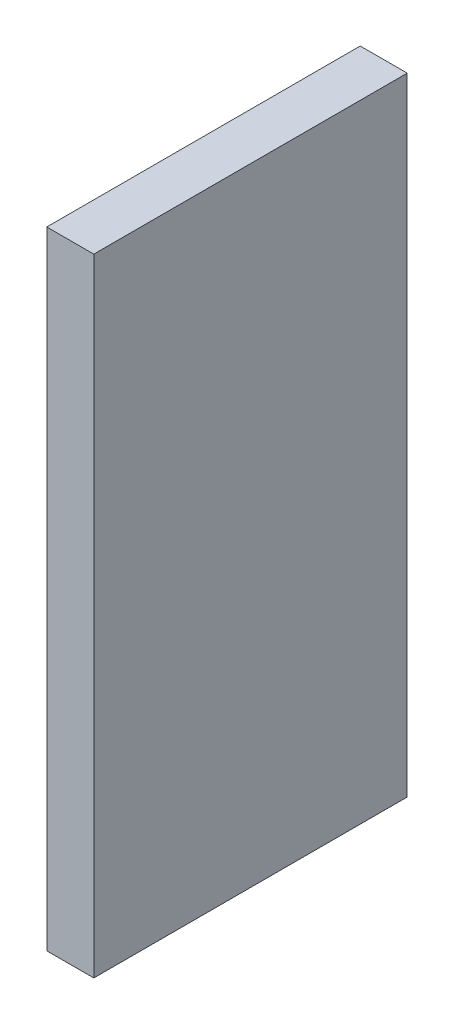
from build123d import *

# Parameters (mm, degrees)
SKETCH1_W           = 80
SKETCH1_H           = 40
BOSS_EXTRUDE2_DEPTH = 6


with BuildPart() as part:
    # Sketch1 → Boss-Extrude2 (new body)
    with BuildSketch(Plane.YZ):
        Rectangle(SKETCH1_W, SKETCH1_H)
    extrude(amount=BOSS_EXTRUDE2_DEPTH)


solid = part.part
